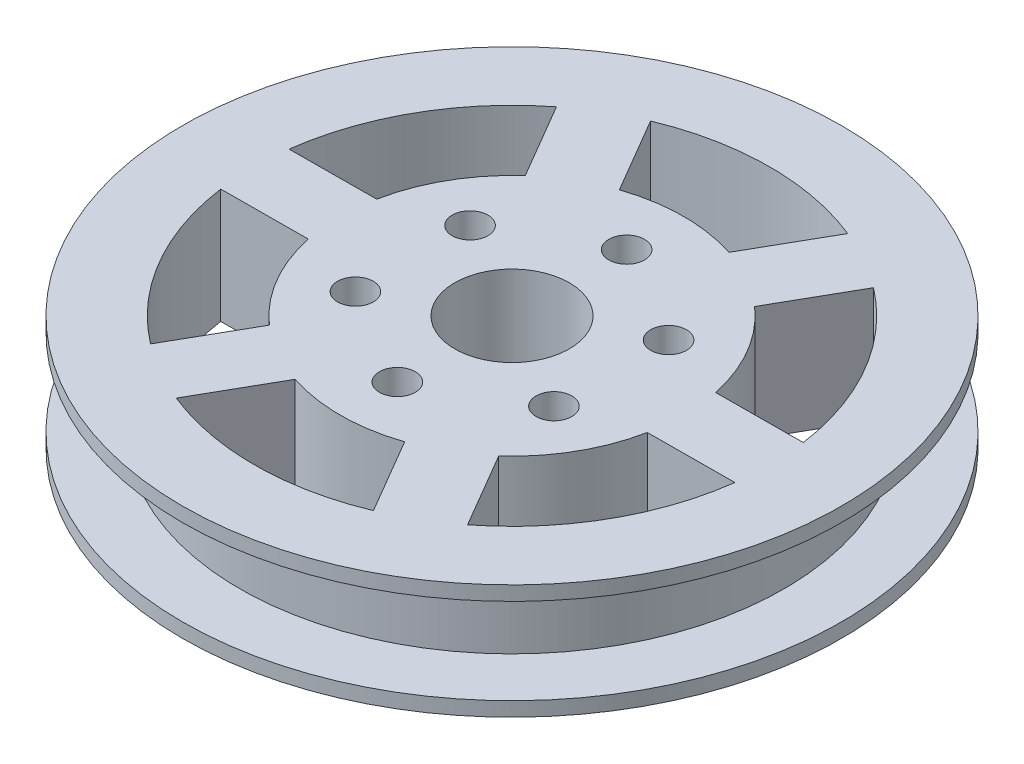
from build123d import *

# Parameters (mm, degrees)
SKETCH2_R           = 60.325
SKETCH2_R_2         = 3.96875
SKETCH2_R_3         = 12.7
BOSS_EXTRUDE1_DEPTH = 19.05
SKETCH3_R           = 73.025
SKETCH3_R_2         = 3.96875
SKETCH3_R_3         = 12.7
BOSS_EXTRUDE2_DEPTH = 3.175
BOSS_EXTRUDE3_START = 3.175
SKETCH4_R           = 73.025
SKETCH4_R_2         = 12.7
SKETCH4_R_3         = 3.96875
BOSS_EXTRUDE3_DEPTH = 3.175
CUT_EXTRUDE1_DEPTH  = 107.350652325


with BuildPart() as part:
    # Sketch2 → Boss-Extrude1 (new body)
    with BuildSketch(Plane(origin=(0, 0, 0), x_dir=(1, 0, 0), z_dir=(0, 1, 0))):
        Circle(SKETCH2_R)
        with Locations((21.997045256, 12.7)):
            Circle(SKETCH2_R_2, mode=Mode.SUBTRACT)
        with Locations((0, 25.4)):
            Circle(SKETCH2_R_2, mode=Mode.SUBTRACT)
        with Locations((-21.997045256, 12.7)):
            Circle(SKETCH2_R_2, mode=Mode.SUBTRACT)
        with Locations((-21.997045256, -12.7)):
            Circle(SKETCH2_R_2, mode=Mode.SUBTRACT)
        with Locations((0, -25.4)):
            Circle(SKETCH2_R_2, mode=Mode.SUBTRACT)
        with Locations((21.997045256, -12.7)):
            Circle(SKETCH2_R_2, mode=Mode.SUBTRACT)
        Circle(SKETCH2_R_3, mode=Mode.SUBTRACT)
    extrude(amount=BOSS_EXTRUDE1_DEPTH)

    # Sketch3 → Boss-Extrude2 (add)
    with BuildSketch(Plane(origin=(0, 19.05, 0), x_dir=(1, 0, 0), z_dir=(0, 1, 0))):
        Circle(SKETCH3_R)
        with Locations((0, 25.4)):
            Circle(SKETCH3_R_2, mode=Mode.SUBTRACT)
        with Locations((21.997045256, 12.7)):
            Circle(SKETCH3_R_2, mode=Mode.SUBTRACT)
        with Locations((21.997045256, -12.7)):
            Circle(SKETCH3_R_2, mode=Mode.SUBTRACT)
        with Locations((0, -25.4)):
            Circle(SKETCH3_R_2, mode=Mode.SUBTRACT)
        with Locations((-21.997045256, -12.7)):
            Circle(SKETCH3_R_2, mode=Mode.SUBTRACT)
        Circle(SKETCH3_R_3, mode=Mode.SUBTRACT)
        with Locations((-21.997045256, 12.7)):
            Circle(SKETCH3_R_2, mode=Mode.SUBTRACT)
    extrude(amount=BOSS_EXTRUDE2_DEPTH)

    # Sketch4 → Boss-Extrude3 (add)
    with BuildSketch(Plane.XZ.offset(BOSS_EXTRUDE3_START)):
        Circle(SKETCH4_R)
        Circle(SKETCH4_R_2, mode=Mode.SUBTRACT)
        with Locations((-21.997045256, -12.7)):
            Circle(SKETCH4_R_3, mode=Mode.SUBTRACT)
        with Locations((0, -25.4)):
            Circle(SKETCH4_R_3, mode=Mode.SUBTRACT)
        with Locations((21.997045256, -12.7)):
            Circle(SKETCH4_R_3, mode=Mode.SUBTRACT)
        with Locations((21.997045256, 12.7)):
            Circle(SKETCH4_R_3, mode=Mode.SUBTRACT)
        with Locations((0, 25.4)):
            Circle(SKETCH4_R_3, mode=Mode.SUBTRACT)
        with Locations((-21.997045256, 12.7)):
            Circle(SKETCH4_R_3, mode=Mode.SUBTRACT)
    extrude(amount=-BOSS_EXTRUDE3_DEPTH)

    # Sketch6 → Cut-Extrude1 (cut, through all)
    with BuildSketch(Plane(origin=(0, 22.225, 0), x_dir=(1, 0, 0), z_dir=(0, 1, 0))):
        with BuildLine():
            Line((-11.853268045, -36.209253467), (-21.409510392, -52.988256857))
            ThreePointArc((-21.409510392, -52.988256857), (0.336081028, -57.149011798), (22.031233101, -52.732791203))
            Line((22.031233101, -52.732791203), (12.27831116, -36.067340837))
            ThreePointArc((12.27831116, -36.067340837), (0.224054036, -38.099341199), (-11.853268045, -36.209253467))
        make_face()
        with BuildLine():
            ThreePointArc((-56.593931754, -7.952948421), (-49.324455505, -28.865560607), (-34.652320142, -45.446003221))
            Line((-34.652320142, -45.446003221), (-25.096077795, -28.666999831))
            ThreePointArc((-25.096077795, -28.666999831), (-32.882970328, -19.243707086), (-37.284767387, -7.839395441))
            Line((-37.284767387, -7.839395441), (-56.593931754, -7.952948421))
        make_face()
        with BuildLine():
            Line((25.431499296, -28.369858011), (35.184421245, -45.035308389))
            ThreePointArc((35.184421245, -45.035308389), (49.66053645, -28.283451336), (56.683553319, -7.286788263))
            Line((56.683553319, -7.286788263), (37.374388951, -7.400341243))
            ThreePointArc((37.374388951, -7.400341243), (33.1070243, -18.855634224), (25.431499296, -28.369858011))
        make_face()
        with BuildLine():
            ThreePointArc((-35.184421082, 45.035308516), (-49.66053645, 28.283451336), (-56.683553345, 7.286788059))
            Line((-56.683553345, 7.286788059), (-37.374388992, 7.400341039))
            ThreePointArc((-37.374388992, 7.400341039), (-33.1070243, 18.855634224), (-25.431499141, 28.36985815))
            Line((-25.431499141, 28.36985815), (-35.184421082, 45.035308516))
        make_face()
        with BuildLine():
            ThreePointArc((21.409510392, 52.988256857), (-0.336080925, 57.149011799), (-22.031232912, 52.732791282))
            Line((-22.031232912, 52.732791282), (-12.278310963, 36.067340904))
            ThreePointArc((-12.278310963, 36.067340904), (-0.224053932, 38.099341199), (11.853268045, 36.209253467))
            Line((11.853268045, 36.209253467), (21.409510392, 52.988256857))
        make_face()
        with BuildLine():
            Line((37.28476743, 7.839395237), (56.593931783, 7.952948217))
            ThreePointArc((56.593931783, 7.952948217), (49.324455557, 28.865560518), (34.652320142, 45.446003221))
            Line((34.652320142, 45.446003221), (25.096077795, 28.666999831))
            ThreePointArc((25.096077795, 28.666999831), (32.88297038, 19.243706997), (37.28476743, 7.839395237))
        make_face()
    extrude(amount=-CUT_EXTRUDE1_DEPTH, mode=Mode.SUBTRACT)


solid = part.part
